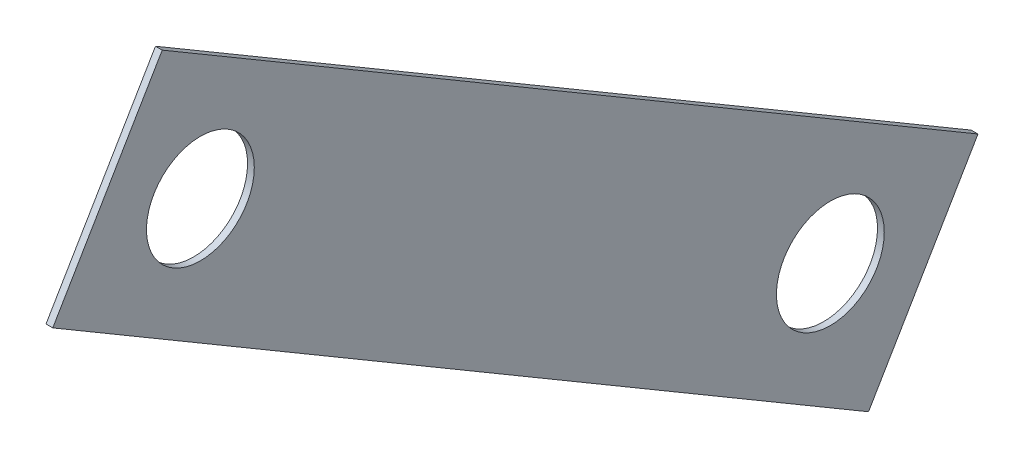
from build123d import *

# Parameters (mm, degrees)
SKETCH1_R           = 25.4
BOSS_EXTRUDE1_DEPTH = 3.175


with BuildPart() as part:
    # Sketch1 → Boss-Extrude1 (new body)
    with BuildSketch(Plane(origin=(0, 0, 0), x_dir=(0, 0, -1), z_dir=(1, 0, 0))):
        Polygon((-217.930559763, 69.412831282), (166.364662086, -156.954353982), (217.930559763, -69.412831282), (-166.364662086, 156.954353982), align=None)
        with Locations((-148.376849574, 87.400643794)):
            Circle(SKETCH1_R, mode=Mode.SUBTRACT)
        with Locations((148.376849574, -87.400643794)):
            Circle(SKETCH1_R, mode=Mode.SUBTRACT)
    extrude(amount=BOSS_EXTRUDE1_DEPTH)


solid = part.part
